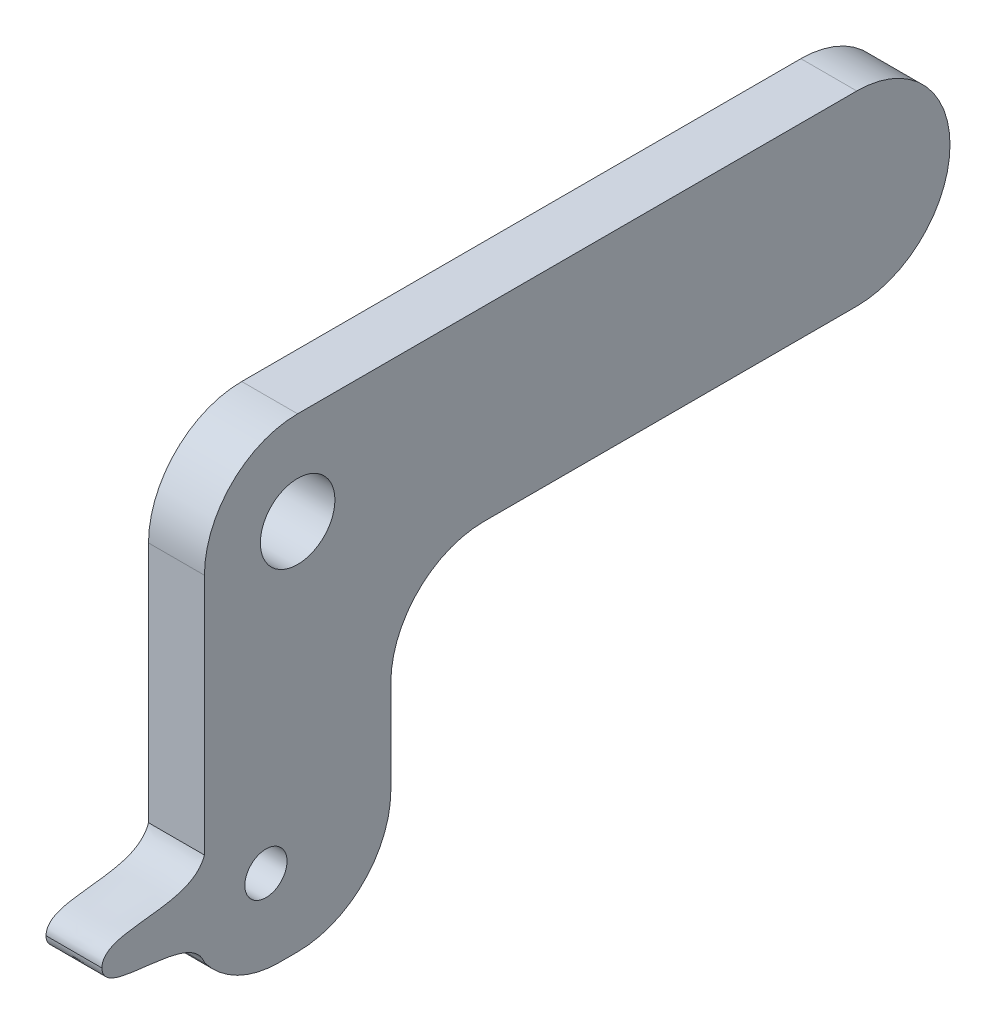
from build123d import *

# Parameters (mm, degrees)
SKETCH1_R           = 2
BOSS_EXTRUDE1_DEPTH = 3
SKETCH2_R           = 1.1303
CUT_EXTRUDE1_DEPTH  = 41.422765863
BOSS_EXTRUDE4_DEPTH = 3
FILLET1_R           = 5


with BuildPart() as part:
    # Sketch1 → Boss-Extrude1 (new body)
    with BuildSketch(Plane(origin=(0, 0, 0), x_dir=(0, 0, -1), z_dir=(1, 0, 0))):
        Polygon((-5, 5), (35, 5), (35, -5), (5, -5), (5, -20), (-5, -20), align=None)
        Circle(SKETCH1_R, mode=Mode.SUBTRACT)
    extrude(amount=BOSS_EXTRUDE1_DEPTH)

    # Sketch2 → Cut-Extrude1 (cut, through all)
    with BuildSketch(Plane(origin=(3, 0, 0), x_dir=(0, 0, -1), z_dir=(1, 0, 0))):
        with Locations((-1.7, -15.5)):
            Circle(SKETCH2_R)
    extrude(amount=-CUT_EXTRUDE1_DEPTH, mode=Mode.SUBTRACT)

    # Sketch3 → Boss-Extrude4 (add)
    with BuildSketch(Plane(origin=(3, 0, 0), x_dir=(0, 0, -1), z_dir=(1, 0, 0))):
        with BuildLine():
            Line((-5, -18), (-5, -13))
            add(Edge.make_bspline(
                [(-5, -13), (-5.721407716, -15.082195162), (-10.455731115, -13.770011947), (-10.499261295, -15.5)],
                knots=[0, 0, 0, 0, 1, 1, 1, 1], degree=3))
            add(Edge.make_bspline(
                [(-5, -18), (-5.721407716, -15.917804838), (-10.455731115, -17.229988053), (-10.499261295, -15.5)],
                knots=[0, 0, 0, 0, 1, 1, 1, 1], degree=3))
        make_face()
    extrude(amount=-BOSS_EXTRUDE4_DEPTH)

    # Fillet1
    # the kernel refuses this fillet: 5 mm, written as the material it adds along each edge
    with BuildSketch(Plane(origin=(0, -5, -5), x_dir=(0, 0, -1), z_dir=(1, 0, 0))) as fillet1_piece_1:
        with BuildLine():
            CenterArc((FILLET1_R, -FILLET1_R), FILLET1_R, 90, 90)
            Line((0, -FILLET1_R), (0, 0))
            Line((0, 0), (FILLET1_R, 0))
        make_face()
    extrude(amount=3)
    # the kernel refuses this fillet: 5 mm, written as the material it takes off along each edge
    with BuildSketch(Plane(origin=(-12.5, -20, -5), x_dir=(0, 1, 0), z_dir=(1, 0, 0)), Plane(origin=(-12.5, -5, -35), x_dir=(0, 1, 0), z_dir=(1, 0, 0)), Plane(origin=(-12.5, 5, -35), x_dir=(0, 0, 1), z_dir=(1, 0, 0))) as fillet1_2_piece_1:
        with BuildLine():
            CenterArc((FILLET1_R, FILLET1_R), FILLET1_R, 180, 90)
            Line((0, FILLET1_R), (0, 0))
            Line((0, 0), (FILLET1_R, 0))
        make_face()
    extrude(amount=28, mode=Mode.SUBTRACT)
    with BuildSketch(Plane(origin=(-12.5, 5, 5), x_dir=(0, 0, -1), z_dir=(1, 0, 0))) as fillet1_2_piece_2:
        with BuildLine():
            CenterArc((FILLET1_R, -FILLET1_R), FILLET1_R, 90, 90)
            Line((0, -FILLET1_R), (0, 0))
            Line((0, 0), (FILLET1_R, 0))
        make_face()
    extrude(amount=28, mode=Mode.SUBTRACT)
    with BuildSketch(Plane(origin=(-10, -20, 5), x_dir=(0, 0, -1), z_dir=(1, 0, 0))) as fillet1_2_piece_3:
        with BuildLine():
            CenterArc((4, 5), FILLET1_R, 216.869897646, 53.130102354)
            Line((0, 2), (0, 0))
            Line((0, 0), (4, 0))
        make_face()
    extrude(amount=23, mode=Mode.SUBTRACT)


solid = part.part
